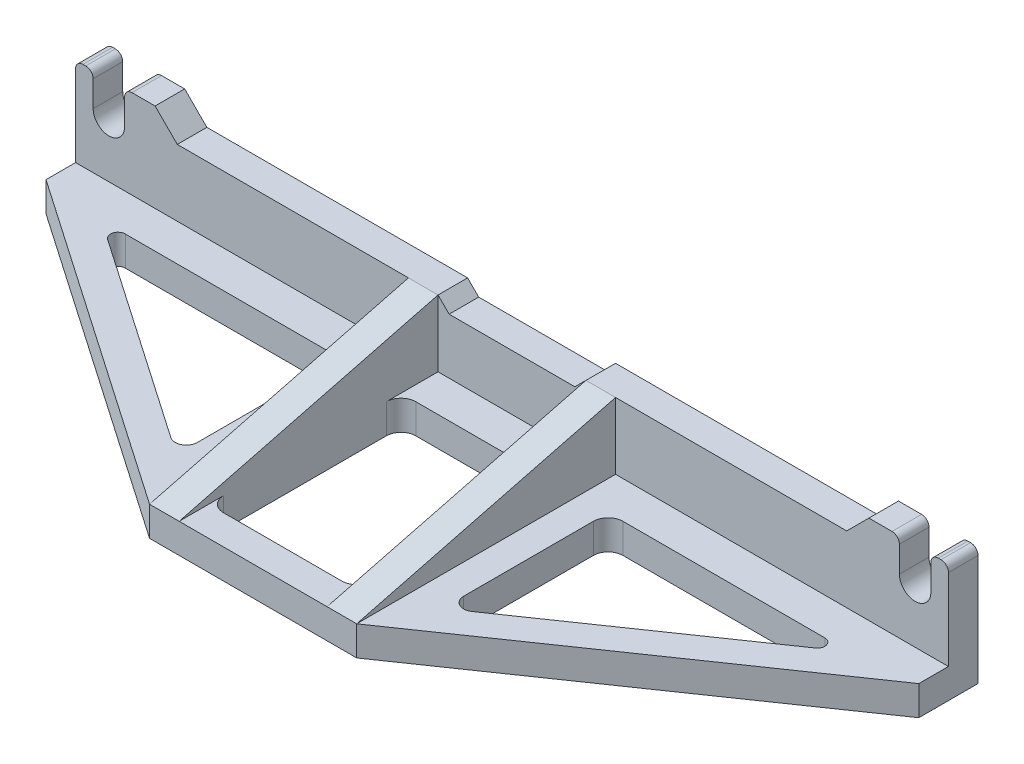
from build123d import *

# Parameters (mm, degrees)
BOSS_EXTRUDE1_DEPTH = 8
BOSS_EXTRUDE2_DEPTH = 8
BOSS_EXTRUDE3_DEPTH = 8
BOSS_EXTRUDE4_DEPTH = 8
SKETCH6_W           = 40
SKETCH6_H           = 52
CUT_EXTRUDE1_DEPTH  = 242.223962325
CUT_EXTRUDE2_DEPTH  = 242.223962325
FILLET1_R           = 4
FILLET2_R           = 2
FILLET3_R           = 4
FILLET4_R           = 3
FILLET5_R           = 2


with BuildPart() as part:
    # Sketch1 → Boss-Extrude1 (new body)
    with BuildSketch(Plane.XY):
        with BuildLine():
            Line((4.25, 9), (4.25, 0))
            ThreePointArc((4.25, 0), (0, -4.25), (-4.25, 0))
            Line((-4.25, 0), (-4.25, 9))
            Line((-4.25, 9), (-12.5, 9))
            Line((-12.5, 9), (-18.5, 3))
            Line((-18.5, 3), (-89, 3))
            Line((-89, 3), (-92, 0))
            Line((-92, 0), (-126, 0))
            Line((-126, 0), (-129, 3))
            Line((-129, 3), (-199.5, 3))
            Line((-199.5, 3), (-205.5, 9))
            Line((-205.5, 9), (-213.75, 9))
            Line((-213.75, 9), (-213.75, 0))
            ThreePointArc((-213.75, 0), (-218, -4.25), (-222.25, 0))
            Line((-222.25, 0), (-222.25, 9))
            Line((-222.25, 9), (-227, 9))
            Line((-227, 9), (-227, -23))
            Line((-227, -23), (9, -23))
            Line((9, -23), (9, 9))
            Line((9, 9), (4.25, 9))
        make_face()
    extrude(amount=BOSS_EXTRUDE1_DEPTH)

    # Sketch2 → Boss-Extrude2 (add)
    with BuildSketch(Plane.XZ.offset(23)):
        Polygon((-227, 8), (-227, 16), (-137, 78), (-81, 78), (9, 16), (9, 8), align=None)
    extrude(amount=-BOSS_EXTRUDE2_DEPTH)

    # Sketch4 → Boss-Extrude3 (add)
    with BuildSketch(Plane(origin=(-81, 0, 0), x_dir=(0, 0, -1), z_dir=(1, 0, 0))):
        Polygon((-78, -15), (-8, 3), (-8, 0), (-8, -15), align=None)
    extrude(amount=-BOSS_EXTRUDE3_DEPTH)

    # Sketch5 → Boss-Extrude4 (add)
    with BuildSketch(Plane(origin=(-137, 0, 0), x_dir=(0, 0, -1), z_dir=(1, 0, 0))):
        Polygon((-8, 3), (-78, -15), (-8, -15), (-8, 0), align=None)
    extrude(amount=BOSS_EXTRUDE4_DEPTH)

    # Sketch6 → Cut-Extrude1 (cut, through all)
    with BuildSketch(Plane(origin=(0, -15, 0), x_dir=(1, 0, 0), z_dir=(0, 1, 0))):
        with Locations((-109, -44)):
            Rectangle(SKETCH6_W, SKETCH6_H)
    extrude(amount=-CUT_EXTRUDE1_DEPTH, mode=Mode.SUBTRACT)

    # Sketch7 → Cut-Extrude2 (cut, through all)
    with BuildSketch(Plane(origin=(0, -15, 0), x_dir=(1, 0, 0), z_dir=(0, 1, 0))):
        Polygon((-73, -18), (-8.004981773, -18), (-73, -62.77434589), align=None)
        Polygon((-145, -18), (-209.995018227, -18), (-145, -62.77434589), align=None)
    extrude(amount=-CUT_EXTRUDE2_DEPTH, mode=Mode.SUBTRACT)

    # Fillet1
    fillet1_edges = [part.edges().sort_by_distance(p)[0] for p in [
        (-73, -19, 18),
        (-129, -19, 18),
        (-89, -19, 18),
        (-145, -19, 18),
    ]]
    fillet(fillet1_edges, radius=FILLET1_R)

    # Fillet2
    fillet2_edges = [part.edges().sort_by_distance(p)[0] for p in [
        (-209.995018227, -19, 18),
        (-8.004981773, -19, 18),
    ]]
    fillet(fillet2_edges, radius=FILLET2_R)

    # Fillet3
    fillet3_edges = [part.edges().sort_by_distance(p)[0] for p in [
        (-129, -19, 70),
        (-89, -19, 70),
    ]]
    fillet(fillet3_edges, radius=FILLET3_R)

    # Fillet4
    fillet4_edges = [part.edges().sort_by_distance(p)[0] for p in [
        (-73, -19, 62.77434589),
        (-145, -19, 62.77434589),
    ]]
    fillet(fillet4_edges, radius=FILLET4_R)

    # Fillet5
    fillet5_edges = [part.edges().sort_by_distance(p)[0] for p in [
        (9, 9, 4),
        (4.25, 9, 4),
        (-4.25, 9, 4),
        (-213.75, 9, 4),
        (-222.25, 9, 4),
        (-227, 9, 4),
    ]]
    fillet(fillet5_edges, radius=FILLET5_R)


solid = part.part
